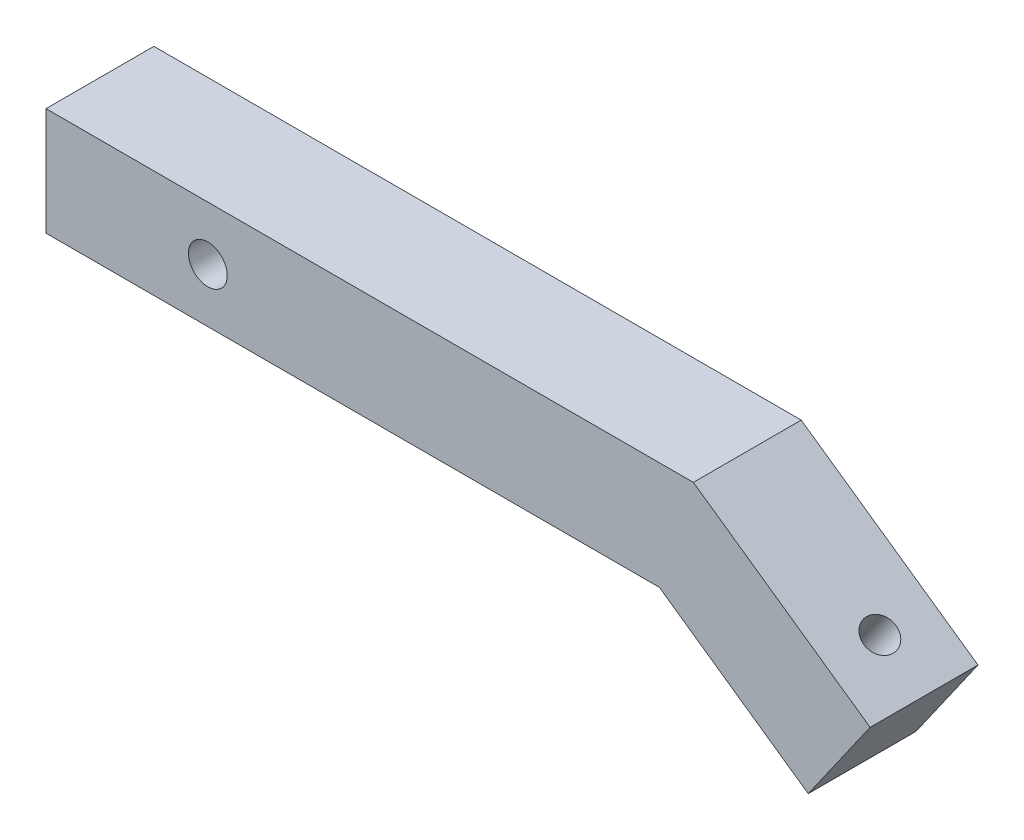
from build123d import *

# Parameters (mm, degrees)
BOSS_EXTRUDE1_DEPTH = 12.7
SKETCH2_R           = 2.286
CUT_EXTRUDE1_DEPTH  = 12.7
SKETCH3_R           = 1.905
CUT_EXTRUDE2_DEPTH  = 12.7


with BuildPart() as part:
    # Sketch1 → Boss-Extrude1 (new body)
    with BuildSketch(Plane.XY):
        Polygon((0, 0), (76.2, 0), (97.006461925, -14.568841483), (89.722041183, -24.972072446), (72.195705381, -12.7), (0, -12.7), align=None)
    extrude(amount=BOSS_EXTRUDE1_DEPTH)

    # Sketch2 → Cut-Extrude1 (cut)
    with BuildSketch(Plane(origin=(0, 0, 0), x_dir=(-1, 0, 0), z_dir=(0, 0, -1))):
        with Locations((-19.05, -6.35)):
            Circle(SKETCH2_R)
    extrude(amount=-CUT_EXTRUDE1_DEPTH, mode=Mode.SUBTRACT)

    # Sketch3 → Cut-Extrude2 (cut)
    with BuildSketch(Plane(origin=(17.784611798, 25.399057889, 0), x_dir=(0.8191520442889908, -0.5735764363510476, 0), z_dir=(-0.5735764363510476, -0.8191520442889909, 0))):
        with Locations((81.469385775, 6.35)):
            Circle(SKETCH3_R)
    extrude(amount=-CUT_EXTRUDE2_DEPTH, mode=Mode.SUBTRACT)


solid = part.part
